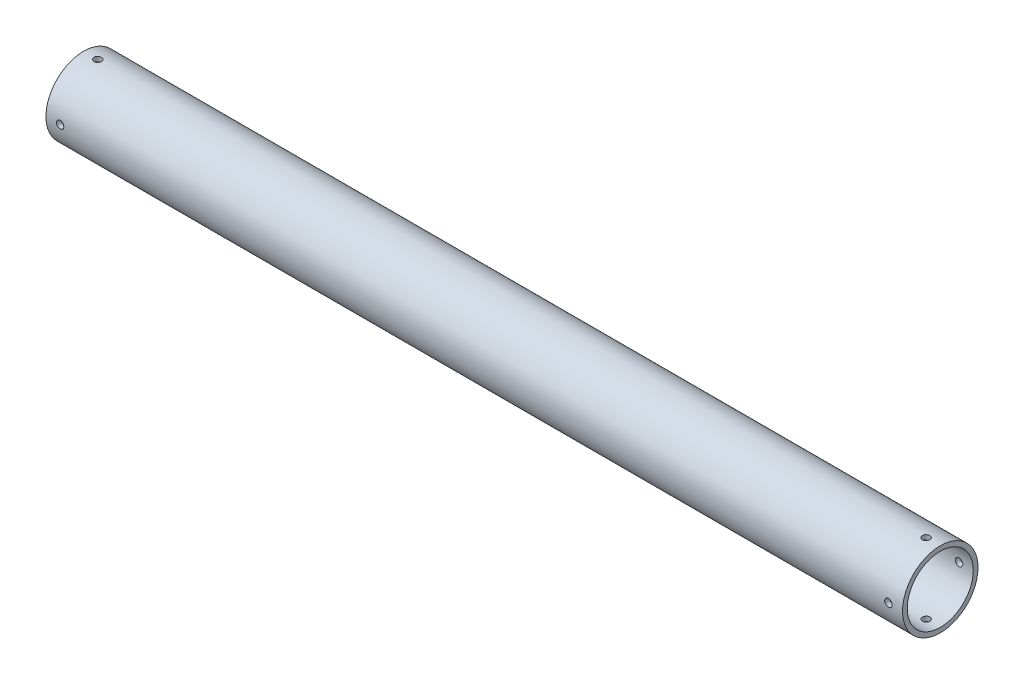
from build123d import *

# Parameters (mm, degrees)
SKETCH1_R               = 25.4
SKETCH1_R_2             = 22.225
BOSS_EXTRUDE1_DEPTH     = 288.29
CUT_EXTRUDE1_DEPTH      = 291.519266315
CUT_EXTRUDE1_DEPTH_BACK = 291.519266315
SKETCH2_R               = 2.4892
CUT_EXTRUDE2_DEPTH      = 291.519266431
CUT_EXTRUDE2_DEPTH_BACK = 291.519266431
SKETCH3_R               = 2.4892


with BuildPart() as part:
    # Sketch1 → Boss-Extrude1 (new, symmetric)
    with BuildSketch(Plane(origin=(0, 0, 0), x_dir=(0, 0, -1), z_dir=(1, 0, 0))):
        Circle(SKETCH1_R)
        Circle(SKETCH1_R_2, mode=Mode.SUBTRACT)
    extrude(amount=BOSS_EXTRUDE1_DEPTH, both=True)

    # Sketch2 → Cut-Extrude1 (cut, two sides: drawn at the far end of the back side and taken through both)
    with BuildSketch(Plane.XY.offset(-CUT_EXTRUDE1_DEPTH_BACK)):
        with Locations((-278.765, 0)):
            Circle(SKETCH2_R)
        with Locations((278.765, 0)):
            Circle(SKETCH2_R)
    extrude(amount=CUT_EXTRUDE1_DEPTH + CUT_EXTRUDE1_DEPTH_BACK, mode=Mode.SUBTRACT)

    # Sketch3 → Cut-Extrude2 (cut, two sides: drawn at the far end of the back side and taken through both)
    with BuildSketch(Plane(origin=(0, 0, 0), x_dir=(1, 0, 0), z_dir=(0, 1, 0)).offset(-CUT_EXTRUDE2_DEPTH_BACK)):
        with Locations((-278.765, 0)):
            Circle(SKETCH3_R)
        with Locations((278.765, 0)):
            Circle(SKETCH3_R)
    extrude(amount=CUT_EXTRUDE2_DEPTH + CUT_EXTRUDE2_DEPTH_BACK, mode=Mode.SUBTRACT)


solid = part.part
